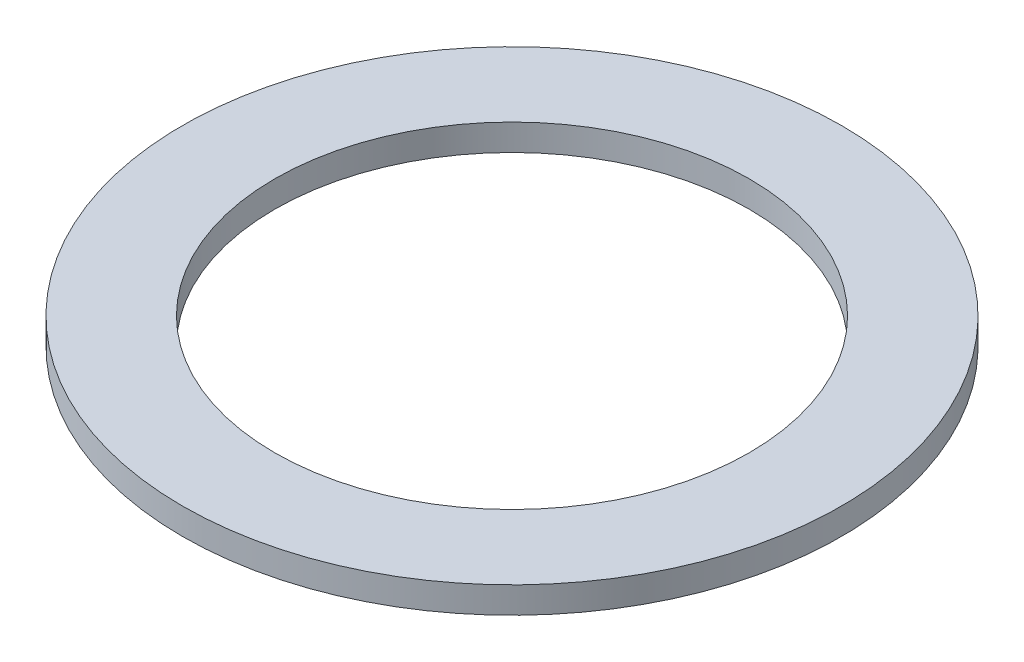
from build123d import *

# Parameters (mm, degrees)
SKETCH1_R           = 62.5
BOSS_EXTRUDE1_DEPTH = 5
SKETCH2_R           = 45
CUT_EXTRUDE1_DEPTH  = 89.529656048


with BuildPart() as part:
    # Sketch1 → Boss-Extrude1 (new body)
    with BuildSketch(Plane(origin=(0, 0, 0), x_dir=(1, 0, 0), z_dir=(0, 1, 0))):
        Circle(SKETCH1_R)
    extrude(amount=BOSS_EXTRUDE1_DEPTH)

    # Sketch2 → Cut-Extrude1 (cut, through all)
    with BuildSketch(Plane(origin=(0, 0, 0), x_dir=(1, 0, 0), z_dir=(0, 1, 0))):
        Circle(SKETCH2_R)
    extrude(amount=CUT_EXTRUDE1_DEPTH, mode=Mode.SUBTRACT)


solid = part.part
